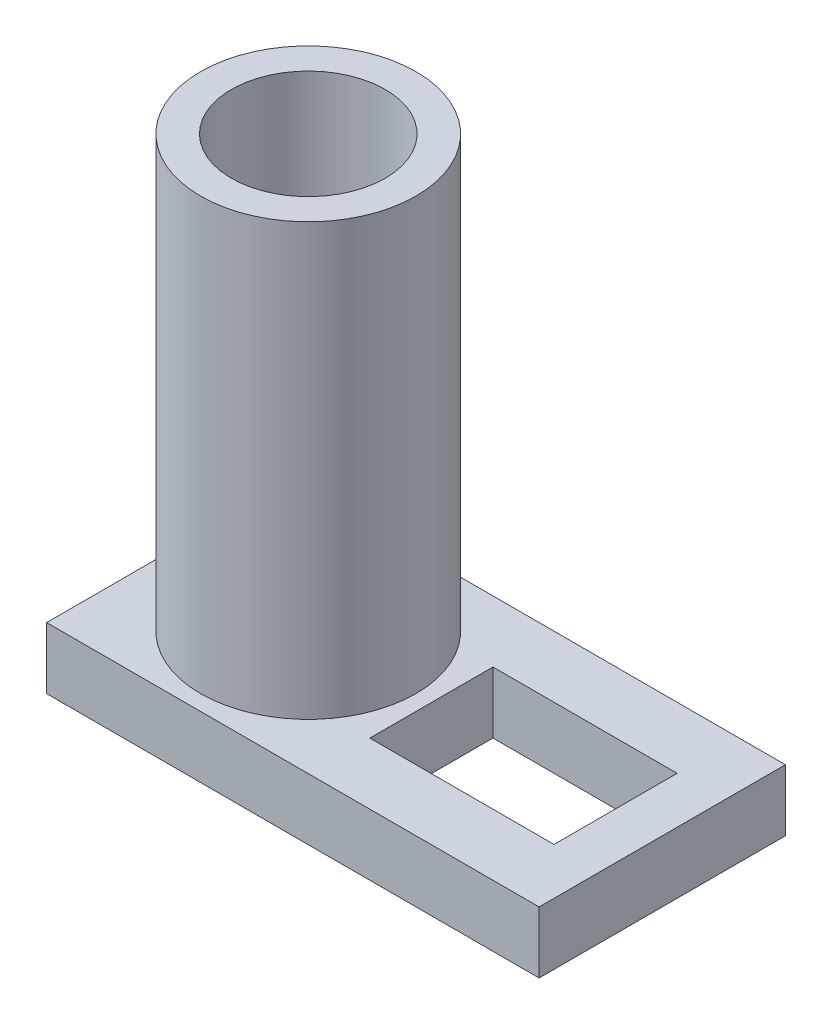
from build123d import *

# Parameters (mm, degrees)
SKETCH_1_W        = 160
SKETCH_1_H        = 80
SKETCH_1_W_2      = 59.835172113
SKETCH_1_H_2      = 40
EXTRUDE_1_DEPTH   = 20
SKETCH_3_R        = 35
SKETCH_3_R_2      = 25
EXTRUDE_1_2_DEPTH = 140


with BuildPart() as part:
    # Эскиз1 → Extrude 1 (new body)
    with BuildSketch(Plane(origin=(0, 0, 0), x_dir=(1, 0, 0), z_dir=(0, 1, 0))):
        with Locations((35, 0)):
            Rectangle(SKETCH_1_W, SKETCH_1_H)
        with Locations((69.917586056, 0)):
            Rectangle(SKETCH_1_W_2, SKETCH_1_H_2, mode=Mode.SUBTRACT)
    extrude(amount=EXTRUDE_1_DEPTH)

    # Эскиз3 → Extrude 1 2 (add)
    with BuildSketch(Plane(origin=(0, 20, 0), x_dir=(1, 0, 0), z_dir=(0, 1, 0))):
        Circle(SKETCH_3_R)
        Circle(SKETCH_3_R_2, mode=Mode.SUBTRACT)
    extrude(amount=EXTRUDE_1_2_DEPTH)


solid = part.part
